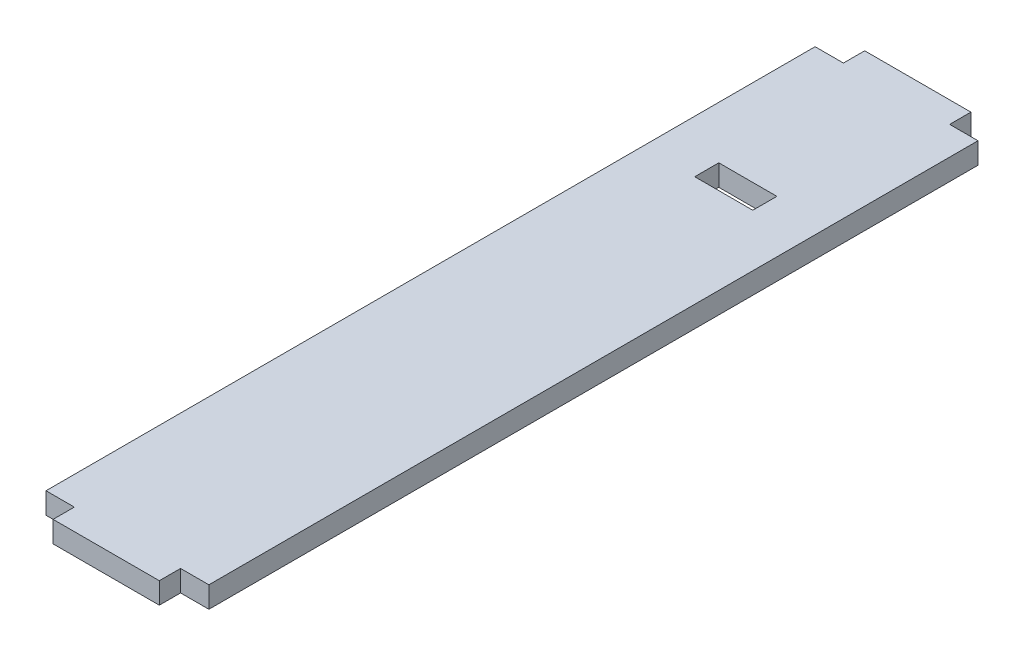
from build123d import *

# Parameters (mm, degrees)
SKETCH1_W           = 4.1
SKETCH1_H           = 1.7
BOSS_EXTRUDE1_DEPTH = 1.5


with BuildPart() as part:
    # Sketch1 → Boss-Extrude1 (new body)
    with BuildSketch(Plane(origin=(0, 0, 0), x_dir=(1, 0, 0), z_dir=(0, 1, 0))):
        Polygon((3.75, 27.15), (5.75, 27.15), (5.75, -12.4), (5.75, -14.1), (5.75, -27.15), (3.75, -27.15), (3.75, -28.65), (-3.75, -28.65), (-3.75, -27.15), (-5.75, -27.15), (-5.75, -16.6), (-5.75, -14.9), (-5.75, 27.15), (-3.75, 27.15), (-3.75, 28.65), (3.75, 28.65), align=None)
        with Locations((0, 15.8)):
            Rectangle(SKETCH1_W, SKETCH1_H, mode=Mode.SUBTRACT)
    extrude(amount=BOSS_EXTRUDE1_DEPTH)


solid = part.part
